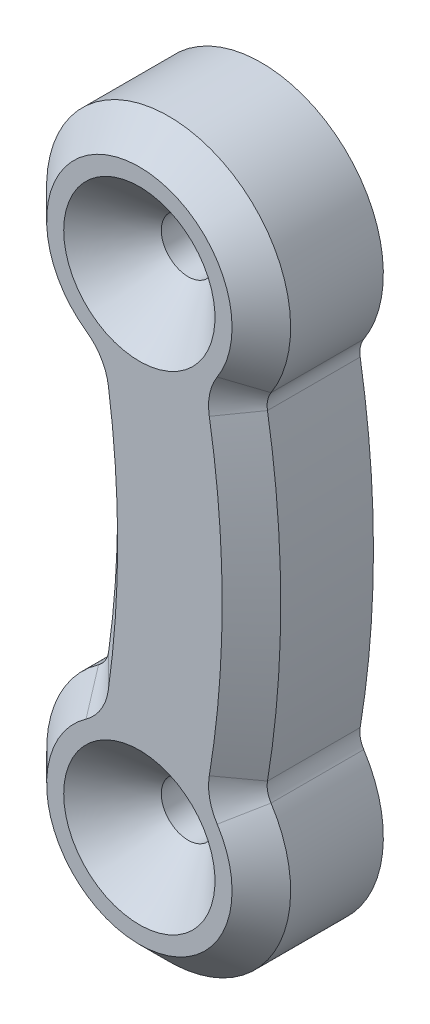
from build123d import *

# Parameters (mm, degrees)
BOSS_EXTRUDE2_DEPTH = 12.5
SKETCH2_R           = 1.65
CUT_EXTRUDE1_DEPTH  = 183.452259897
SKETCH4_R           = 11
CUT_EXTRUDE3_DEPTH  = 3
CHAMFER1_SIZE       = 6
SKETCH32_R          = 1.275
CUT_EXTRUDE6_DEPTH  = 8
SKETCH34_R          = 0.9
CUT_EXTRUDE7_DEPTH  = 8
SKETCH44_R          = 5.5
CUT_EXTRUDE8_DEPTH  = 19
CHAMFER2_SIZE       = 10
CUT_SWEEP1_START    = -10.5
CUT_SWEEP1_DEPTH    = 15


# Read off the part's stored shape, not the designer's step: Cut-Sweep1
with BuildPart() as part:
    # Sketch1 → Boss-Extrude2 (new, symmetric)
    with BuildSketch(Plane.XY):
        with BuildLine():
            ThreePointArc((20.986978603, -67.578728182), (-4.772573404, -29.453707497), (-14.365917101, -74.454146144))
            ThreePointArc((-14.365917101, -74.454146144), (-12.975360601, -75.93457639), (-12.28837595, -77.845956305))
            ThreePointArc((-12.28837595, -77.845956305), (-10.448341727, -103.99393046), (-12.28837595, -130.141904615))
            ThreePointArc((-12.28837595, -130.141904615), (-12.975360601, -132.05328453), (-14.365917101, -133.533714776))
            ThreePointArc((-14.365917101, -133.533714776), (-4.772573404, -178.534153424), (20.986978603, -140.409132739))
            ThreePointArc((20.986978603, -140.409132739), (20.288835581, -138.708883787), (20.252226745, -136.871246725))
            ThreePointArc((20.252226745, -136.871246725), (22.969651044, -103.99393046), (20.252226745, -71.116614196))
            ThreePointArc((20.252226745, -71.116614196), (20.288835581, -69.278977134), (20.986978603, -67.578728182))
        make_face()
    extrude(amount=BOSS_EXTRUDE2_DEPTH, both=True)

    # Sketch2 → Cut-Extrude1 (cut, through all)
    with BuildSketch(Plane.XY.offset(12.5)):
        with Locations((0, -53.99393046)):
            Circle(SKETCH2_R)
        with Locations((0, -153.99393046)):
            Circle(SKETCH2_R)
    extrude(amount=-CUT_EXTRUDE1_DEPTH, mode=Mode.SUBTRACT)

    # Sketch4 → Cut-Extrude3 (cut)
    with BuildSketch(Plane(origin=(0, 0, -12.5), x_dir=(-1, 0, 0), z_dir=(0, 0, -1))):
        with Locations((0, -53.99393046)):
            Circle(SKETCH4_R)
        with Locations((0, -153.99393046)):
            Circle(SKETCH4_R)
    extrude(amount=-CUT_EXTRUDE3_DEPTH, mode=Mode.SUBTRACT)

    # Chamfer1
    chamfer1_edges = [part.edges().sort_by_distance(p)[0] for p in [
        (20.288835581, -69.278977134, 12.5),
        (-4.772573404, -29.453707497, 12.5),
        (-12.975360601, -75.93457639, 12.5),
        (-10.448341727, -103.99393046, 12.5),
        (-12.975360601, -132.05328453, 12.5),
        (-4.772573404, -178.534153424, 12.5),
        (20.288835581, -138.708883787, 12.5),
        (22.969651044, -103.99393046, 12.5),
    ]]
    chamfer(chamfer1_edges, length=CHAMFER1_SIZE)

    # Sketch32 → Cut-Extrude6 (cut)
    with BuildSketch(Plane(origin=(0, 0, -12.5), x_dir=(-1, 0, 0), z_dir=(0, 0, -1))):
        with Locations((-2.194575755, -147.346838069)):
            Circle(SKETCH32_R)
        with Locations((6.647092391, -151.799354705)):
            Circle(SKETCH32_R)
        with Locations((-6.647092391, -156.188506215)):
            Circle(SKETCH32_R)
        with Locations((2.194575755, -160.641022851)):
            Circle(SKETCH32_R)
    extrude(amount=-CUT_EXTRUDE6_DEPTH, mode=Mode.SUBTRACT)

    # Sketch34 → Cut-Extrude7 (cut)
    with BuildSketch(Plane(origin=(0, 0, -9.5), x_dir=(-1, 0, 0), z_dir=(0, 0, -1))):
        with Locations((-6.647092391, -51.799354705)):
            Circle(SKETCH34_R)
        with Locations((2.194575755, -47.346838069)):
            Circle(SKETCH34_R)
        with Locations((6.647092391, -56.188506215)):
            Circle(SKETCH34_R)
        with Locations((-2.194575755, -60.641022851)):
            Circle(SKETCH34_R)
        with Locations((-2.194575755, -147.346838069)):
            Circle(SKETCH34_R)
        with Locations((-6.647092391, -156.188506215)):
            Circle(SKETCH34_R)
        with Locations((2.194575755, -160.641022851)):
            Circle(SKETCH34_R)
        with Locations((6.647092391, -151.799354705)):
            Circle(SKETCH34_R)
    extrude(amount=-CUT_EXTRUDE7_DEPTH, mode=Mode.SUBTRACT)

    # Sketch44 → Cut-Extrude8 (cut)
    with BuildSketch(Plane.XY.offset(12.5)):
        with Locations((0, -53.99393046)):
            Circle(SKETCH44_R)
        with Locations((0, -153.99393046)):
            Circle(SKETCH44_R)
    extrude(amount=-CUT_EXTRUDE8_DEPTH, mode=Mode.SUBTRACT)

    # Chamfer2
    chamfer2_edges = [part.edges().sort_by_distance(p)[0] for p in [
        (-5.5, -53.99393046, 12.5),
        (-5.5, -153.99393046, 12.5),
    ]]
    chamfer(chamfer2_edges, length=CHAMFER2_SIZE)

    # Cut-Sweep1 outline → Cut-Sweep1 (cut)
    with BuildSketch(Plane.XY.offset(CUT_SWEEP1_START)):
        with BuildLine():
            Line((-2.026503985, -76.769481595), (-12.443832541, -76.769481595))
            ThreePointArc((-12.443832541, -76.769481595), (-12.365320392, -77.307605752), (-12.28837595, -77.845956305))
            ThreePointArc((-12.28837595, -77.845956305), (-11.957138623, -80.305626129), (-11.658625557, -82.769481595))
            Line((-11.658625557, -82.769481595), (-2.026503985, -82.769481595))
            ThreePointArc((-2.026503985, -82.769481595), (1.509029921, -84.233947689), (2.973496015, -87.769481595))
            Line((2.973496015, -87.769481595), (2.973496015, -114.4079942))
            ThreePointArc((2.973496015, -114.4079942), (1.509029921, -117.943528106), (-2.026503985, -119.4079942))
            Line((-2.026503985, -119.4079942), (-11.085695711, -119.4079942))
            ThreePointArc((-11.085695711, -119.4079942), (-11.358836079, -122.410395034), (-11.680419149, -125.4079942))
            Line((-11.680419149, -125.4079942), (-2.026503985, -125.4079942))
            ThreePointArc((-2.026503985, -125.4079942), (5.751670608, -122.186168793), (8.973496015, -114.4079942))
            Line((8.973496015, -114.4079942), (8.973496015, -87.769481595))
            ThreePointArc((8.973496015, -87.769481595), (5.751670608, -79.991307002), (-2.026503985, -76.769481595))
        make_face()
    extrude(amount=CUT_SWEEP1_DEPTH, mode=Mode.SUBTRACT)


solid = part.part
